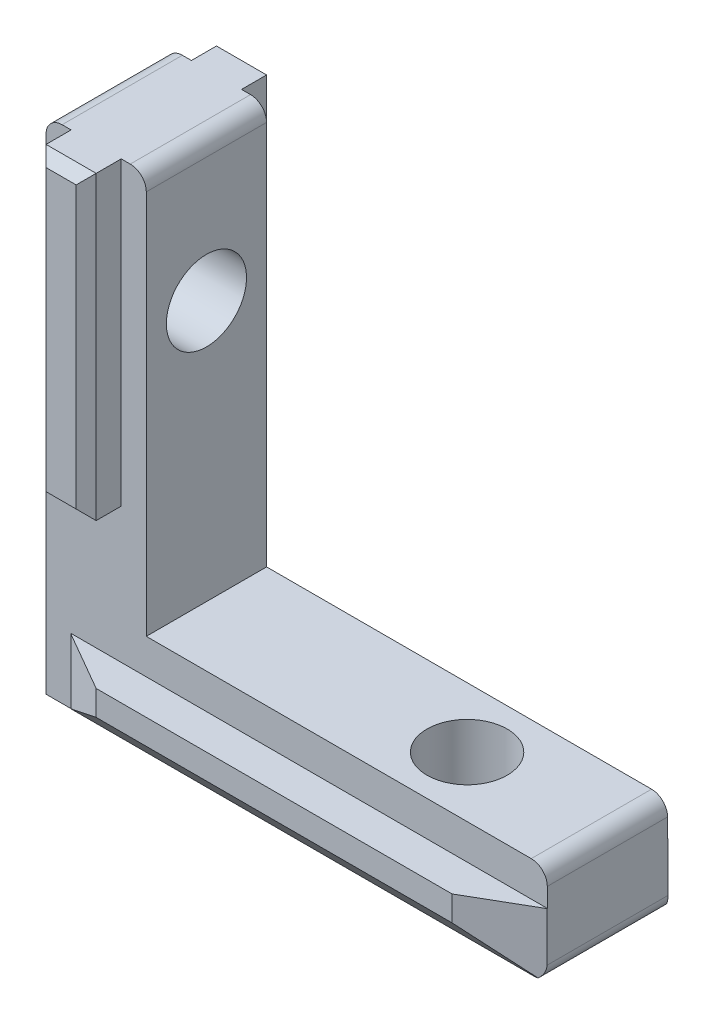
from build123d import *

# Parameters (mm, degrees)
EXTRUDE1_DEPTH      = 3
EXTRUDE1_DEPTH_BACK = 3
SKETCH2_W           = 2.5
SKETCH2_H           = 15
SKETCH2_W_2         = 23.75
SKETCH2_H_2         = 3.25
EXTRUDE2_DEPTH      = 1.75
CHAMFER1_SIZE       = 3
CHAMFER1_SIZE2      = 1.732050808
CHAMFER2_SIZE       = 2
CHAMFER2_SIZE2      = 1.738573476
CHAMFER3_SIZE       = 0.5
EXTRUDE3_REACH      = 30.68
SKETCH4_R           = 2
FILLET1_R           = 0.8


# Read off the part's stored shape, not the designer's step: Mirror1
with BuildPart() as part:
    # Sketch1 → Extrude1 (new, two sides: drawn at the far end of the back side and taken through both)
    with BuildSketch(Plane.XY.offset(-EXTRUDE1_DEPTH_BACK)):
        Polygon((0, 0), (0, 20), (-5, 20), (-5, -5), (20, -5), (20, 0), align=None)
    extrude(amount=EXTRUDE1_DEPTH + EXTRUDE1_DEPTH_BACK)

    # Sketch2 → Extrude2 (add)
    with BuildSketch(Plane.XY.offset(3)):
        with Locations((-2.5, 12.5)):
            Rectangle(SKETCH2_W, SKETCH2_H)
        with Locations((8.125, -3.375)):
            Rectangle(SKETCH2_W_2, SKETCH2_H_2)
    extrude(amount=EXTRUDE2_DEPTH)

    # Chamfer1
    chamfer1_edges = [part.edges().sort_by_distance(p)[0] for p in [
        (20, -3.375, 4.75),
        (-3.75, -3.375, 4.75),
    ]]
    chamfer1_side = [part.faces().sort_by_distance(p)[0] for p in [
        (8.125, -3.375, 4.75),
    ]]
    chamfer(chamfer1_edges, length=CHAMFER1_SIZE, length2=CHAMFER1_SIZE2, reference=chamfer1_side[0])

    # Chamfer2
    chamfer2_edges = [part.edges().sort_by_distance(p)[0] for p in [
        (8.125, -5, 4.75),
    ]]
    chamfer2_side = [part.faces().sort_by_distance(p)[0] for p in [
        (8.125, -3.375, 4.75),
    ]]
    chamfer(chamfer2_edges, length=CHAMFER2_SIZE, length2=CHAMFER2_SIZE2, reference=chamfer2_side[0])

    # Chamfer3
    chamfer3_edges = [part.edges().sort_by_distance(p)[0] for p in [
        (-2.5, 20, 4.75),
        (-1.25, 12.5, 4.75),
        (-2.5, 5, 4.75),
        (-3.75, 12.5, 4.75),
    ]]
    chamfer(chamfer3_edges, length=CHAMFER3_SIZE)

    # Mirror1: part across plane


with BuildPart() as part_1:
    add(part.part)
    add(part.part.mirror(Plane.XY))

    # Sketch4 → Extrude3 (cut, up to next)
    with BuildSketch(Plane(origin=(0, 0, 0), x_dir=(1, 0, 0), z_dir=(0, 1, 0)), mode=Mode.PRIVATE) as extrude3_sk1:
        with Locations(Location((13, 0, 0), (0, 0, 270))):
            Circle(SKETCH4_R)
    extrude3_tool1 = extrude(extrude3_sk1.sketch, amount=-EXTRUDE3_REACH, mode=Mode.PRIVATE) & part_1.part
    extrude3 = extrude3_tool1.solids().sort_by_distance((13, 0, 0))[0]
    add(extrude3, mode=Mode.SUBTRACT)

    # Mirror2: Extrude3 across plane
    add(extrude3.mirror(Plane(origin=(0, 0, 0), x_dir=(0, 0, 1), z_dir=(0.7071067811865476, -0.7071067811865475, 0))), mode=Mode.SUBTRACT)

    # Fillet1
    fillet1_edges = [part_1.edges().sort_by_distance(p)[0] for p in [
        (-5, 20, 0),
        (20, -5, 0),
        (20, 0, 0),
        (0, 20, 0),
    ]]
    fillet(fillet1_edges, radius=FILLET1_R)


solid = part_1.part
